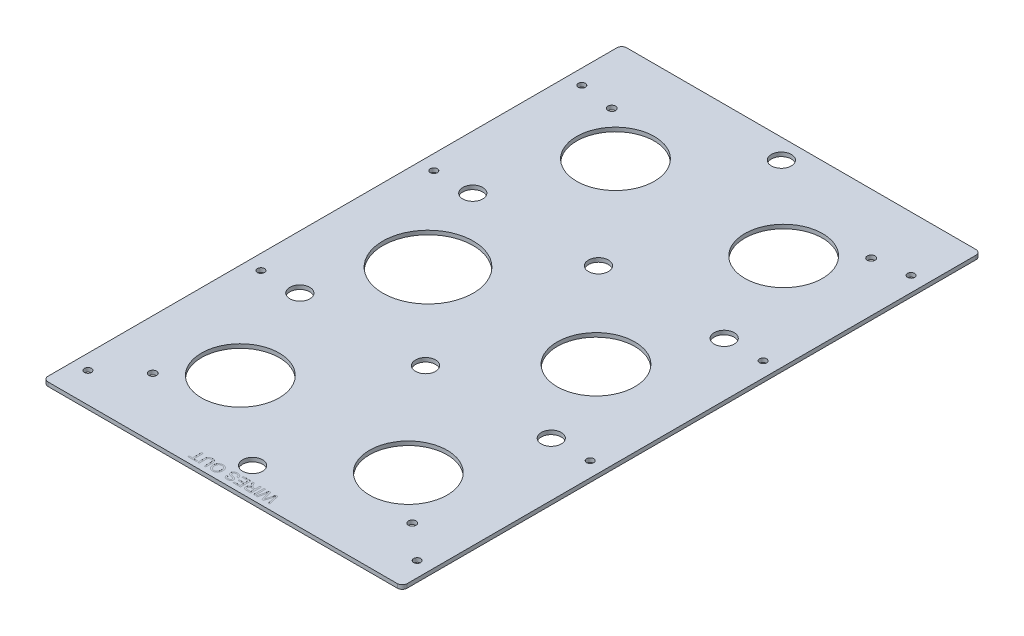
from build123d import *

# Parameters (mm, degrees)
SKETCH1_R           = 24.727
SKETCH1_R_2         = 28.76928198
SKETCH1_R_3         = 6.35
SKETCH1_R_4         = 2.45745
SKETCH1_R_5         = 2.2479
BOSS_EXTRUDE1_DEPTH = 2.54
SKETCH2_W           = 0.941716851
SKETCH2_H           = 6.677628581
CUT_EXTRUDE2_DEPTH  = 0.0254


with BuildPart() as part:
    # Sketch1 → Boss-Extrude1 (new body)
    with BuildSketch(Plane(origin=(0, 0, 0), x_dir=(1, 0, 0), z_dir=(0, 1, 0))):
        with BuildLine():
            Line((423.571752778, 200.667091319), (645.821752778, 200.667091319))
            ThreePointArc((645.821752778, 200.667091319), (648.066816808, 199.737155349), (648.996752778, 197.492091319))
            Line((648.996752778, 197.492091319), (648.996752778, -164.457908681))
            ThreePointArc((648.996752778, -164.457908681), (648.066816808, -166.702972712), (645.821752778, -167.632908681))
            Line((645.821752778, -167.632908681), (423.571752778, -167.632908681))
            ThreePointArc((423.571752778, -167.632908681), (421.326688747, -166.702972712), (420.396752778, -164.457908681))
            Line((420.396752778, -164.457908681), (420.396752778, 197.492091319))
            ThreePointArc((420.396752778, 197.492091319), (421.326688747, 199.737155349), (423.571752778, 200.667091319))
        make_face()
        with Locations((588.214552778, -102.991490365)):
            Circle(SKETCH1_R, mode=Mode.SUBTRACT)
        with Locations((588.214552778, 16.452800477)):
            Circle(SKETCH1_R, mode=Mode.SUBTRACT)
        with Locations((481.178952778, -102.862908681)):
            Circle(SKETCH1_R, mode=Mode.SUBTRACT)
        with Locations((481.178952778, 135.897091319)):
            Circle(SKETCH1_R, mode=Mode.SUBTRACT)
        with Locations((588.214552778, 135.897091319)):
            Circle(SKETCH1_R, mode=Mode.SUBTRACT)
        with Locations((481.178952778, 16.58138216)):
            Circle(SKETCH1_R_2, mode=Mode.SUBTRACT)
        with Locations((534.696752778, -148.582908681)):
            Circle(SKETCH1_R_3, mode=Mode.SUBTRACT)
        with Locations((614.706752778, -38.512008681)):
            Circle(SKETCH1_R_3, mode=Mode.SUBTRACT)
        with Locations((534.696752778, -38.516242015)):
            Circle(SKETCH1_R_3, mode=Mode.SUBTRACT)
        with Locations((454.686752778, -38.512008681)):
            Circle(SKETCH1_R_3, mode=Mode.SUBTRACT)
        with Locations((614.706752778, 71.546191319)):
            Circle(SKETCH1_R_3, mode=Mode.SUBTRACT)
        with Locations((534.696752778, 71.550424652)):
            Circle(SKETCH1_R_3, mode=Mode.SUBTRACT)
        with Locations((454.686752778, 71.546191319)):
            Circle(SKETCH1_R_3, mode=Mode.SUBTRACT)
        with Locations((534.696752778, 187.967091319)):
            Circle(SKETCH1_R_3, mode=Mode.SUBTRACT)
        with Locations((617.246752778, 162.567091319)):
            Circle(SKETCH1_R_4, mode=Mode.SUBTRACT)
        with Locations((452.146752778, 162.567091319)):
            Circle(SKETCH1_R_4, mode=Mode.SUBTRACT)
        with Locations((452.146752778, -129.532908681)):
            Circle(SKETCH1_R_4, mode=Mode.SUBTRACT)
        with Locations((617.246752778, -129.532908681)):
            Circle(SKETCH1_R_4, mode=Mode.SUBTRACT)
        with Locations((429.921752778, 165.742091319)):
            Circle(SKETCH1_R_5, mode=Mode.SUBTRACT)
        with Locations((429.921752778, 71.550424652)):
            Circle(SKETCH1_R_5, mode=Mode.SUBTRACT)
        with Locations((639.471752778, 165.742091319)):
            Circle(SKETCH1_R_5, mode=Mode.SUBTRACT)
        with Locations((639.471752778, 71.550424652)):
            Circle(SKETCH1_R_5, mode=Mode.SUBTRACT)
        with Locations((639.471752778, -38.516242015)):
            Circle(SKETCH1_R_5, mode=Mode.SUBTRACT)
        with Locations((429.921752778, -38.516242015)):
            Circle(SKETCH1_R_5, mode=Mode.SUBTRACT)
        with Locations((429.921752778, -148.582908681)):
            Circle(SKETCH1_R_5, mode=Mode.SUBTRACT)
        with Locations((639.471752778, -148.582908681)):
            Circle(SKETCH1_R_5, mode=Mode.SUBTRACT)
    extrude(amount=BOSS_EXTRUDE1_DEPTH)

    # Sketch2 → Cut-Extrude2 (cut)
    # profile 1 of 8: a face of its own
    with BuildSketch(Plane(origin=(0, 2.54, 0), x_dir=(1, 0, 0), z_dir=(0, 1, 0))):
        with BuildLine():
            Line((559.722342991, -157.632908681), (561.40378913, -164.310537262))
            Line((561.40378913, -164.310537262), (560.431305961, -164.310537262))
            Line((560.431305961, -164.310537262), (559.440095469, -159.918979844))
            add(Edge.make_bspline(
                [(559.440095469, -159.918979844), (559.388724776, -159.692489489), (559.286507843, -159.241821061), (559.185401446, -158.790902189), (559.135107625, -158.566599537)],
                knots=[0, 0, 0, 0, 1.00513078, 2, 2, 2, 2], degree=3))
            add(Edge.make_bspline(
                [(559.135107625, -158.566599537), (559.111295079, -158.647253219), (559.06634133, -158.799512675), (559.005572574, -159.015355126), (558.950378261, -159.203736415), (558.903355538, -159.365534749), (558.865281421, -159.500977443), (558.832408661, -159.608400186), (558.810002998, -159.689906664), (558.796725362, -159.734841456), (558.791327468, -159.753109262)],
                knots=[0, 0, 0, 0, 1.633809233, 3.084334118, 4.356383392, 5.447555203, 6.357852567, 7.089694452, 7.629924063, 8, 8, 8, 8], degree=3))
            Line((558.791327468, -159.753109262), (557.47238881, -164.310537262))
            Line((557.47238881, -164.310537262), (556.339385723, -164.310537262))
            Line((556.339385723, -164.310537262), (555.385629878, -160.965034642))
            add(Edge.make_bspline(
                [(555.385629878, -160.965034642), (555.332995836, -160.758362611), (555.229212897, -160.350850094), (555.091320512, -159.743845105), (554.964050247, -159.15156618), (554.890740185, -158.759838157), (554.854576483, -158.566599537)],
                knots=[0, 0, 0, 0, 1.04154457, 2.053700482, 3.039894486, 4, 4, 4, 4], degree=3))
            add(Edge.make_bspline(
                [(554.854576483, -158.566599537), (554.832195947, -158.665121557), (554.784917359, -158.873248025), (554.712211253, -159.201717256), (554.629692894, -159.562133235), (554.573549402, -159.813277801), (554.544237976, -159.944395498)],
                knots=[0, 0, 0, 0, 0.858436457, 1.813435672, 2.858437265, 4, 4, 4, 4], degree=3))
            Line((554.544237976, -159.944395498), (553.558378147, -164.310537262))
            Line((553.558378147, -164.310537262), (552.585894978, -164.310537262))
            Line((552.585894978, -164.310537262), (554.268678783, -157.632908681))
            Line((554.268678783, -157.632908681), (555.304032253, -157.632908681))
            Line((555.304032253, -157.632908681), (556.699217872, -162.736104402))
            add(Edge.make_bspline(
                [(556.699217872, -162.736104402), (556.713227546, -162.785992883), (556.739840708, -162.88076242), (556.774724331, -163.016001761), (556.809317368, -163.134939198), (556.836832717, -163.239111801), (556.860644948, -163.327469834), (556.881731697, -163.3997546), (556.895294127, -163.457380827), (556.905101846, -163.490133861), (556.909231431, -163.503924675)],
                knots=[0, 0, 0, 0, 1.562239628, 2.967673567, 4.210417925, 5.296319877, 6.215971374, 6.969386481, 7.566055473, 8, 8, 8, 8], degree=3))
            add(Edge.make_bspline(
                [(556.909231431, -163.503924675), (556.93405705, -163.416488876), (556.981082165, -163.250866474), (557.049566538, -163.0180006), (557.108445927, -162.81366071), (557.145087528, -162.687497031), (557.162050302, -162.629091123)],
                knots=[0, 0, 0, 0, 1.197732026, 2.268764715, 3.198546125, 4, 4, 4, 4], degree=3))
            Line((557.162050302, -162.629091123), (558.608067228, -157.632908681))
            Line((558.608067228, -157.632908681), (559.722342991, -157.632908681))
        make_face()
    # profile 2 of 8: a face of its own
    with BuildSketch(Plane(origin=(0, 2.54, 0), x_dir=(1, 0, 0), z_dir=(0, 1, 0))):
        with Locations((551.430151571, -160.971722972)):
            Rectangle(SKETCH2_W, SKETCH2_H)
    # profile 3 of 8: a face of its own
    with BuildSketch(Plane(origin=(0, 2.54, 0), x_dir=(1, 0, 0), z_dir=(0, 1, 0))):
        with BuildLine():
            Line((549.418301934, -157.632908681), (549.418301934, -164.310537262))
            Line((549.418301934, -164.310537262), (546.520917417, -164.310537262))
            add(Edge.make_bspline(
                [(546.520917417, -164.310537262), (546.452692559, -164.310005228), (546.32065133, -164.308975537), (546.129169583, -164.301617616), (545.95086287, -164.285985708), (545.784607427, -164.268526778), (545.630687741, -164.242748327), (545.489030458, -164.212505555), (545.360178866, -164.176762115), (545.243152545, -164.134511886), (545.134568815, -164.086727744), (545.033948542, -164.027737254), (544.936971287, -163.963207594), (544.84750278, -163.886763469), (544.761513388, -163.804632521), (544.682603234, -163.712705305), (544.608436978, -163.613282674), (544.518260608, -163.469308867), (544.423550867, -163.276322235), (544.341975762, -163.031134683), (544.290104766, -162.774393872), (544.284505479, -162.599018952), (544.281664564, -162.510038851)],
                knots=[0, 0, 0, 0, 1.242075696, 2.40389213, 3.487198984, 4.500157661, 5.446319301, 6.326791195, 7.136300648, 7.878370406, 8.590488565, 9.292260633, 9.999224673, 10.708050372, 11.431369221, 12.162165018, 12.910600795, 13.687589445, 15.252257874, 16.810406251, 18.381693487, 20, 20, 20, 20], degree=3))
            add(Edge.make_bspline(
                [(544.281664564, -162.510038851), (544.28297127, -162.452917353), (544.285552103, -162.340098479), (544.305321257, -162.174224351), (544.341092711, -162.015738993), (544.386960042, -161.863251141), (544.449747785, -161.718933253), (544.522451415, -161.579793134), (544.612647929, -161.449818753), (544.713357171, -161.324666237), (544.830463791, -161.209983484), (544.960726064, -161.103989028), (545.1080602, -161.013027964), (545.267633909, -160.928495648), (545.443559659, -160.859072611), (545.633184323, -160.797943376), (545.83797549, -160.750811011), (545.979919299, -160.727069922), (546.052734324, -160.714891103)],
                knots=[0, 0, 0, 0, 0.982645791, 1.940792824, 2.867691729, 3.775150443, 4.675643875, 5.571354211, 6.471357401, 7.392684514, 8.331098131, 9.285922955, 10.275520706, 11.304845665, 12.388884831, 13.524255008, 14.729980297, 16, 16, 16, 16], degree=3))
            add(Edge.make_bspline(
                [(546.052734324, -160.714891103), (545.998803964, -160.688009316), (545.896529863, -160.63703041), (545.757356704, -160.552682069), (545.635434829, -160.473275324), (545.56617817, -160.413731461), (545.533719923, -160.385825272)],
                knots=[0, 0, 0, 0, 1.172551213, 2.223638478, 3.167479604, 4, 4, 4, 4], degree=3))
            add(Edge.make_bspline(
                [(545.533719923, -160.385825272), (545.470531772, -160.324072838), (545.34094328, -160.197428765), (545.164102858, -159.979716317), (544.989121368, -159.740294935), (544.884066136, -159.565824165), (544.830107616, -159.476212404)],
                knots=[0, 0, 0, 0, 0.918170575, 1.883016652, 2.912673989, 4, 4, 4, 4], degree=3))
            Line((544.830107616, -159.476212404), (543.734559177, -157.632908681))
            Line((543.734559177, -157.632908681), (544.814055625, -157.632908681))
            Line((544.814055625, -157.632908681), (545.646083865, -159.042808626))
            add(Edge.make_bspline(
                [(545.646083865, -159.042808626), (545.676001254, -159.092275432), (545.73397624, -159.18813398), (545.81768902, -159.328150929), (545.899877098, -159.456985803), (545.975734741, -159.578649241), (546.050072727, -159.689932731), (546.116711758, -159.795047844), (546.183634726, -159.888039759), (546.260477146, -159.999758964), (546.354320897, -160.12054763), (546.46382992, -160.244632721), (546.56451618, -160.347419301), (546.691748968, -160.445491362), (546.849956269, -160.53528591), (546.983347585, -160.577882041), (547.047957814, -160.598514163)],
                knots=[0, 0, 0, 0, 1.130591283, 2.190900266, 3.190104209, 4.119071823, 4.994606968, 5.807262858, 6.55236009, 7.234593472, 8.459046683, 9.540234366, 10.471327768, 11.266723835, 12.676093724, 14, 14, 14, 14], degree=3))
            add(Edge.make_bspline(
                [(547.047957814, -160.598514163), (547.075100451, -160.603408903), (547.137067905, -160.614583741), (547.242288488, -160.621882045), (547.369776133, -160.629628219), (547.462168601, -160.629402522), (547.51212791, -160.62928048)],
                knots=[0, 0, 0, 0, 0.709978628, 1.620902492, 2.713552433, 4, 4, 4, 4], degree=3))
            Line((547.51212791, -160.62928048), (548.476585083, -160.62928048))
            Line((548.476585083, -160.62928048), (548.476585083, -157.632908681))
            Line((548.476585083, -157.632908681), (549.418301934, -157.632908681))
        make_face()
        with BuildLine():
            Line((548.476585083, -161.399776086), (546.688125665, -161.399776086))
            add(Edge.make_bspline(
                [(546.688125665, -161.399776086), (546.598441482, -161.401167081), (546.430785313, -161.403767415), (546.196404283, -161.426311968), (545.995914421, -161.461552337), (545.826754763, -161.515076519), (545.684592564, -161.586755961), (545.561380252, -161.674412982), (545.457780216, -161.783162134), (545.372578132, -161.907859175), (545.305973355, -162.043753081), (545.259433313, -162.187580097), (545.22818796, -162.336582269), (545.224993173, -162.438537714), (545.223381415, -162.489973861)],
                knots=[0, 0, 0, 0, 1.546056516, 2.890207646, 4.055830773, 5.050253158, 5.937355789, 6.790906573, 7.644595853, 8.512568064, 9.38593768, 10.244184789, 11.114197691, 12, 12, 12, 12], degree=3))
            add(Edge.make_bspline(
                [(545.223381415, -162.489973861), (545.224618751, -162.527458437), (545.227042329, -162.600879709), (545.239882746, -162.708606586), (545.264312756, -162.810695223), (545.298047274, -162.907881527), (545.340760095, -163.000376502), (545.393247395, -163.08781636), (545.455238343, -163.169754494), (545.526349228, -163.246594289), (545.60796875, -163.316521605), (545.701205409, -163.376850866), (545.805314667, -163.428118515), (545.920420133, -163.468807733), (546.046158457, -163.501352546), (546.183245656, -163.523003545), (546.331054739, -163.538670141), (546.433477865, -163.539575943), (546.486138102, -163.540041657)],
                knots=[0, 0, 0, 0, 0.965235723, 1.89061323, 2.787065514, 3.661873922, 4.534873316, 5.404925039, 6.281839248, 7.175200054, 8.095223355, 9.040740021, 10.02630299, 11.075573487, 12.177989335, 13.364883635, 14.645170704, 16, 16, 16, 16], degree=3))
            Line((546.486138102, -163.540041657), (548.476585083, -163.540041657))
            Line((548.476585083, -163.540041657), (548.476585083, -161.399776086))
        make_face(mode=Mode.SUBTRACT)
    # profile 4 of 8: a face of its own
    with BuildSketch(Plane(origin=(0, 2.54, 0), x_dir=(1, 0, 0), z_dir=(0, 1, 0))):
        Polygon((542.740673353, -157.632908681), (542.740673353, -164.310537262), (538.032089097, -164.310537262), (538.032089097, -163.540041657), (541.798956502, -163.540041657), (541.798956502, -161.485386709), (538.288920966, -161.485386709), (538.288920966, -160.714891103), (541.798956502, -160.714891103), (541.798956502, -158.403404287), (537.860867852, -158.403404287), (537.860867852, -157.632908681), align=None)
    # profile 5 of 8: a face of its own
    with BuildSketch(Plane(origin=(0, 2.54, 0), x_dir=(1, 0, 0), z_dir=(0, 1, 0))):
        with BuildLine():
            Line((536.919151001, -159.944395498), (535.977434149, -159.944395498))
            add(Edge.make_bspline(
                [(535.977434149, -159.944395498), (535.967099447, -159.859829448), (535.947245927, -159.697373513), (535.891294024, -159.467321186), (535.820807728, -159.25994257), (535.728061286, -159.075450502), (535.61414462, -158.90945451), (535.471617002, -158.762452209), (535.300465931, -158.633409818), (535.104726492, -158.523070597), (534.890547961, -158.430125565), (534.659820918, -158.364923014), (534.415960386, -158.325384135), (534.2488754, -158.320359384), (534.163559078, -158.317793664)],
                knots=[0, 0, 0, 0, 1.125761249, 2.162647979, 3.12492346, 4.01623828, 4.884793378, 5.777219259, 6.711258599, 7.709587174, 8.742442187, 9.791331093, 10.872217593, 12, 12, 12, 12], degree=3))
            add(Edge.make_bspline(
                [(534.163559078, -158.317793664), (534.088075472, -158.319197344), (533.941338698, -158.321926035), (533.728224529, -158.354491854), (533.528255497, -158.402670123), (533.343591959, -158.471961543), (533.177945071, -158.559061508), (533.030912287, -158.658515842), (532.90896415, -158.777039758), (532.810320251, -158.908038635), (532.733767063, -159.0471478), (532.68039687, -159.190660225), (532.64446456, -159.335781279), (532.640558852, -159.434093517), (532.638619859, -159.482900734)],
                knots=[0, 0, 0, 0, 1.267544124, 2.464049433, 3.614542348, 4.719673496, 5.768837234, 6.754183997, 7.692231426, 8.612479311, 9.501217876, 10.350240008, 11.180974857, 12, 12, 12, 12], degree=3))
            add(Edge.make_bspline(
                [(532.638619859, -159.482900734), (532.640665535, -159.531229084), (532.644667914, -159.625783812), (532.676417933, -159.762658445), (532.727722813, -159.890016468), (532.799690966, -160.00894435), (532.897502083, -160.118722921), (533.023983613, -160.216173588), (533.175612186, -160.308864856), (533.289773133, -160.358297227), (533.350258161, -160.384487606)],
                knots=[0, 0, 0, 0, 0.942081658, 1.843188798, 2.725198023, 3.611401405, 4.541884661, 5.575766242, 6.715586633, 8, 8, 8, 8], degree=3))
            add(Edge.make_bspline(
                [(533.350258161, -160.384487606), (533.373783734, -160.394141859), (533.426932275, -160.415952572), (533.518027268, -160.444823213), (533.626118392, -160.482172301), (533.753417286, -160.520437731), (533.900055849, -160.561437411), (534.064688983, -160.608621488), (534.248622783, -160.657756276), (534.445415748, -160.709772669), (534.644614114, -160.762532304), (534.834897576, -160.816478017), (535.011047166, -160.86764307), (535.172392375, -160.920229175), (535.319087714, -160.972129915), (535.451533958, -161.023009908), (535.569966713, -161.071603021), (535.642299162, -161.107339688), (535.676459303, -161.124216894)],
                knots=[0, 0, 0, 0, 0.499208779, 1.12780332, 1.87546358, 2.745246929, 3.737578632, 4.865834649, 6.108484299, 7.476352792, 8.863398792, 10.155242256, 11.360521946, 12.465428895, 13.487415091, 14.415997097, 15.251929613, 16, 16, 16, 16], degree=3))
            add(Edge.make_bspline(
                [(535.676459303, -161.124216894), (535.755002663, -161.166726358), (535.906611787, -161.248780688), (536.111451179, -161.394622954), (536.281150592, -161.559612867), (536.42109584, -161.737381778), (536.529142747, -161.928850953), (536.605479995, -162.131923291), (536.65505586, -162.345806507), (536.65987107, -162.492817705), (536.662319132, -162.567558488)],
                knots=[0, 0, 0, 0, 1.158956011, 2.237086722, 3.252429106, 4.221720014, 5.165272549, 6.094237939, 7.031106807, 8, 8, 8, 8], degree=3))
            add(Edge.make_bspline(
                [(536.662319132, -162.567558488), (536.659145253, -162.650346649), (536.652832429, -162.815011702), (536.59669433, -163.056600056), (536.507282806, -163.289830041), (536.404288244, -163.474420688), (536.305316187, -163.614577488), (536.222135201, -163.713957894), (536.130348142, -163.806380687), (536.03196227, -163.89376346), (535.923425255, -163.972838858), (535.807988168, -164.046251884), (535.68328631, -164.112037731), (535.50673448, -164.192242907), (535.271906117, -164.274474337), (534.976237199, -164.345718883), (534.665033701, -164.387424656), (534.452620181, -164.393199013), (534.344143986, -164.396147885)],
                knots=[0, 0, 0, 0, 1.200056028, 2.386902731, 3.579012093, 4.815906327, 5.442508847, 6.067203999, 6.694073756, 7.331409728, 7.974631341, 8.640655778, 9.315145047, 10.018831381, 11.453504181, 12.917815188, 14.425977399, 16, 16, 16, 16], degree=3))
            add(Edge.make_bspline(
                [(534.344143986, -164.396147885), (534.225391409, -164.393512718), (533.994599467, -164.388391352), (533.659011915, -164.343225433), (533.345074452, -164.270447043), (533.099322959, -164.184703485), (532.91716066, -164.099475426), (532.78875982, -164.030796118), (532.669168796, -163.953393884), (532.556105476, -163.871439291), (532.453610512, -163.77959394), (532.357450754, -163.682688125), (532.269243926, -163.578853804), (532.164495795, -163.430552422), (532.053850912, -163.232219998), (531.953928801, -162.977837198), (531.889942405, -162.707360999), (531.875474296, -162.521515965), (531.868124254, -162.42710356)],
                knots=[0, 0, 0, 0, 1.607451709, 3.124032445, 4.575401297, 5.965664223, 6.638286369, 7.297495781, 7.935629741, 8.566004073, 9.186263309, 9.796807256, 10.413736732, 11.028594479, 12.253110936, 13.478624344, 14.719098735, 16, 16, 16, 16], degree=3))
            Line((531.868124254, -162.42710356), (532.809841105, -162.42710356))
            add(Edge.make_bspline(
                [(532.809841105, -162.42710356), (532.81562815, -162.4749674), (532.82696333, -162.568719073), (532.858762759, -162.70345659), (532.896799486, -162.830012271), (532.945167565, -162.946963749), (533.002893506, -163.055345187), (533.07136604, -163.153920439), (533.147875112, -163.244555146), (533.234266603, -163.325658718), (533.331357869, -163.396884385), (533.439169244, -163.458441163), (533.557300996, -163.511053804), (533.686899001, -163.551613997), (533.826230383, -163.585296013), (533.976898124, -163.609473802), (534.138375502, -163.621998491), (534.249596497, -163.624412897), (534.306689338, -163.625652279)],
                knots=[0, 0, 0, 0, 1.074256797, 2.104164074, 3.082231143, 4.018364317, 4.921387537, 5.814946689, 6.689553043, 7.561782592, 8.450683137, 9.368204304, 10.325224224, 11.328240899, 12.391723181, 13.519579538, 14.726730929, 16, 16, 16, 16], degree=3))
            add(Edge.make_bspline(
                [(534.306689338, -163.625652279), (534.366035525, -163.625210853), (534.480915147, -163.624356359), (534.64695209, -163.608493069), (534.800971481, -163.587108964), (534.942023864, -163.554283581), (535.071425464, -163.515663761), (535.186906528, -163.46380454), (535.291219455, -163.40534535), (535.382461854, -163.336821312), (535.461105742, -163.260852496), (535.531689661, -163.182815544), (535.588602258, -163.098627915), (535.63871673, -163.012951296), (535.673634386, -162.921228935), (535.701043956, -162.827451385), (535.717710478, -162.729557833), (535.719625026, -162.663042802), (535.720602281, -162.629091123)],
                knots=[0, 0, 0, 0, 1.464224776, 2.834379057, 4.11387117, 5.299348816, 6.406355048, 7.441191667, 8.417293255, 9.352838038, 10.248153785, 11.113750317, 11.944205591, 12.75240885, 13.557683963, 14.358962649, 15.162355132, 16, 16, 16, 16], degree=3))
            add(Edge.make_bspline(
                [(535.720602281, -162.629091123), (535.718168663, -162.571639742), (535.713445235, -162.460131908), (535.665212127, -162.30171289), (535.59102927, -162.15730369), (535.517947336, -162.078731382), (535.48116007, -162.039180425)],
                knots=[0, 0, 0, 0, 1.050964922, 2.039826012, 3.013306874, 4, 4, 4, 4], degree=3))
            add(Edge.make_bspline(
                [(535.48116007, -162.039180425), (535.457969771, -162.019414746), (535.406685856, -161.975704166), (535.311264203, -161.917858418), (535.192955623, -161.859412216), (535.050968951, -161.801314272), (534.885551449, -161.742847517), (534.696956535, -161.682692414), (534.484109364, -161.622638631), (534.25405831, -161.56570571), (534.021978303, -161.507248785), (533.801731722, -161.449648546), (533.598727955, -161.395820096), (533.415304405, -161.339779945), (533.24844288, -161.290624887), (533.101451026, -161.238724735), (532.971688042, -161.191625956), (532.892222033, -161.15838142), (532.855321748, -161.142944217)],
                knots=[0, 0, 0, 0, 0.523895407, 1.158562347, 1.913798076, 2.79478753, 3.797549825, 4.933675542, 6.202127117, 7.604032848, 9.013379355, 10.32225155, 11.523321485, 12.628397413, 13.623935419, 14.51727859, 15.311493772, 16, 16, 16, 16], degree=3))
            add(Edge.make_bspline(
                [(532.855321748, -161.142944217), (532.807300629, -161.120819928), (532.713043221, -161.077393655), (532.579670537, -161.003035247), (532.454410737, -160.926481026), (532.341164328, -160.842122338), (532.234366601, -160.757650818), (532.139464727, -160.666329918), (532.054417312, -160.570308455), (531.953674878, -160.438378462), (531.850336256, -160.260306632), (531.761549753, -160.030161174), (531.7060115, -159.784270007), (531.699976744, -159.614733125), (531.696903008, -159.528381377)],
                knots=[0, 0, 0, 0, 0.899363591, 1.76530001, 2.59691609, 3.395188894, 4.166615117, 4.912545108, 5.632755751, 6.347510175, 7.734752518, 9.118421309, 10.532299558, 12, 12, 12, 12], degree=3))
            add(Edge.make_bspline(
                [(531.696903008, -159.528381377), (531.700443023, -159.441124746), (531.707488803, -159.267455692), (531.766370035, -159.011848), (531.860846991, -158.764675669), (531.970194907, -158.568583503), (532.073971507, -158.418582646), (532.161120281, -158.310759961), (532.257770914, -158.211063889), (532.361534971, -158.116367519), (532.473220907, -158.028605511), (532.59376808, -157.947741253), (532.721910394, -157.872958183), (532.904868974, -157.781728519), (533.148158262, -157.686990369), (533.457107708, -157.604818345), (533.783892935, -157.556127476), (534.007778273, -157.550282456), (534.122091433, -157.547298058)],
                knots=[0, 0, 0, 0, 1.196987384, 2.382393894, 3.582009067, 4.820735309, 5.454243406, 6.085350439, 6.72189866, 7.359035515, 8.013098289, 8.67027723, 9.350744424, 10.048966745, 11.475869723, 12.9268444, 14.430883741, 16, 16, 16, 16], degree=3))
            add(Edge.make_bspline(
                [(534.122091433, -157.547298058), (534.194787777, -157.547975042), (534.337634537, -157.549305301), (534.547073108, -157.562493925), (534.747206944, -157.586322036), (534.938836729, -157.613902371), (535.121058459, -157.655354933), (535.294917718, -157.702126873), (535.458828623, -157.760803852), (535.614596134, -157.825361377), (535.760794209, -157.901642644), (535.900492499, -157.983398277), (536.030310426, -158.077181973), (536.154094296, -158.176638928), (536.268109269, -158.287282967), (536.373674536, -158.406532114), (536.47193749, -158.534115384), (536.561156051, -158.670170701), (536.640803351, -158.81313801), (536.712505816, -158.960532385), (536.77251151, -159.113140053), (536.821961187, -159.270602244), (536.862439284, -159.432204152), (536.8913014, -159.599022237), (536.912253487, -159.770009971), (536.916838249, -159.885923643), (536.919151001, -159.944395498)],
                knots=[0, 0, 0, 0, 1.259929758, 2.475735005, 3.634725603, 4.752877801, 5.82919746, 6.871690464, 7.871395985, 8.84458164, 9.791640072, 10.727373556, 11.647336026, 12.564665335, 13.477425593, 14.397128332, 15.323044476, 16.266184727, 17.214251675, 18.157898412, 19.105082968, 20.053433368, 21.01687335, 21.990151059, 22.98614553, 24, 24, 24, 24], degree=3))
        make_face()
    # profile 6 of 8: a face of its own
    with BuildSketch(Plane(origin=(0, 2.54, 0), x_dir=(1, 0, 0), z_dir=(0, 1, 0))):
        with BuildLine():
            add(Edge.make_bspline(
                [(528.186867472, -160.883437017), (528.18453093, -161.017312794), (528.179978296, -161.278162957), (528.137941893, -161.658076342), (528.068593879, -162.015098517), (527.973198508, -162.350880998), (527.846319517, -162.66289135), (527.695771151, -162.954966283), (527.513106957, -163.222022193), (527.306708274, -163.467146872), (527.076107188, -163.683835182), (526.830598567, -163.876290687), (526.567097553, -164.036820026), (526.28804371, -164.169364681), (525.992250127, -164.271128541), (525.680547659, -164.342372526), (525.353269573, -164.388331813), (525.129567345, -164.393504685), (525.015261429, -164.396147885)],
                knots=[0, 0, 0, 0, 1.203593535, 2.345140965, 3.431924157, 4.471254512, 5.478692091, 6.45615896, 7.42038538, 8.382007041, 9.33218277, 10.260966195, 11.182476517, 12.100814648, 13.034113903, 13.98924309, 14.972556454, 16, 16, 16, 16], degree=3))
            add(Edge.make_bspline(
                [(525.015261429, -164.396147885), (524.939866448, -164.394843312), (524.790145653, -164.392252667), (524.568399649, -164.3721473), (524.352618273, -164.337238773), (524.142675062, -164.288675423), (523.938260336, -164.227577692), (523.73950904, -164.152118347), (523.546103587, -164.063842538), (523.359775663, -163.961244553), (523.181848561, -163.8457953), (523.013048497, -163.720694705), (522.855997914, -163.583433614), (522.709938897, -163.435833724), (522.573742411, -163.277970932), (522.451761008, -163.106896927), (522.336774764, -162.928014603), (522.235961336, -162.737217508), (522.144571604, -162.538889961), (522.067967494, -162.33217238), (522.000128037, -162.120027321), (521.945351476, -161.901137147), (521.904520595, -161.674877343), (521.873123308, -161.44287377), (521.856169491, -161.203837004), (521.853190039, -161.042642875), (521.851681382, -160.961021644)],
                knots=[0, 0, 0, 0, 1.034176269, 2.053687022, 3.051235935, 4.030520976, 5.007759882, 5.975670013, 6.944584641, 7.921900115, 8.890679583, 9.85222947, 10.801660264, 11.7488817, 12.698942795, 13.658174729, 14.62880618, 15.613957309, 16.61577279, 17.622338666, 18.636016077, 19.670029534, 20.714984856, 21.788550191, 22.880224384, 24, 24, 24, 24], degree=3))
            add(Edge.make_bspline(
                [(521.851681382, -160.961021644), (521.853072713, -160.87805609), (521.855821525, -160.714143333), (521.874421114, -160.47199404), (521.907125658, -160.236796351), (521.950502666, -160.007848949), (522.008626533, -159.785628455), (522.077697817, -159.569497748), (522.161243435, -159.36074415), (522.255598947, -159.158864507), (522.362362122, -158.966635418), (522.480129319, -158.785400846), (522.608983195, -158.6168568), (522.746969289, -158.458933097), (522.896846371, -158.314898626), (523.05745678, -158.182609526), (523.228472072, -158.062634985), (523.409221897, -157.954267331), (523.596818494, -157.858979835), (523.788984061, -157.774772138), (523.98594523, -157.706640897), (524.18482042, -157.646211439), (524.388571028, -157.602759574), (524.595275781, -157.57038093), (524.806233365, -157.551447507), (524.947895826, -157.548688315), (525.019274427, -157.547298058)],
                knots=[0, 0, 0, 0, 1.141458971, 2.255149016, 3.338763392, 4.407145747, 5.45911027, 6.497028761, 7.526847988, 8.550472592, 9.561035647, 10.549629976, 11.521388012, 12.477647518, 13.432134385, 14.377847498, 15.337760086, 16.303574593, 17.274809663, 18.230970776, 19.187525402, 20.140611526, 21.088808525, 22.051011914, 23.017975238, 24, 24, 24, 24], degree=3))
            add(Edge.make_bspline(
                [(525.019274427, -157.547298058), (525.096012226, -157.548486946), (525.248010587, -157.550841835), (525.472905681, -157.572522757), (525.691462139, -157.609637941), (525.904930207, -157.656227701), (526.110934371, -157.721638318), (526.311198264, -157.798708143), (526.504237219, -157.891974124), (526.691042947, -157.997332028), (526.869942046, -158.114136731), (527.037141566, -158.243512661), (527.195108541, -158.380916881), (527.339031948, -158.53167661), (527.473222178, -158.691075567), (527.59722857, -158.86049706), (527.709298938, -159.040789768), (527.808812233, -159.230989268), (527.89854682, -159.426268703), (527.974191087, -159.626526161), (528.040656527, -159.828854312), (528.093592291, -160.034488525), (528.135774912, -160.24295756), (528.164139843, -160.453913699), (528.184625162, -160.66767135), (528.186116274, -160.811153192), (528.186867472, -160.883437017)],
                knots=[0, 0, 0, 0, 1.072846099, 2.125039441, 3.155166917, 4.171599398, 5.177324298, 6.174217088, 7.169783185, 8.172042761, 9.17156421, 10.154239632, 11.126115549, 12.096189878, 13.065322046, 14.038037562, 15.029377678, 16.03062832, 17.03785952, 18.032507603, 19.022297599, 20.014323703, 20.999862951, 21.994471951, 22.989647507, 24, 24, 24, 24], degree=3))
        make_face()
        with BuildLine():
            add(Edge.make_bspline(
                [(527.245150621, -160.872735689), (527.243708302, -160.776329083), (527.240895881, -160.588343004), (527.208690701, -160.314276393), (527.159881949, -160.055654115), (527.092407359, -159.811871377), (527.002320553, -159.584720283), (526.892178815, -159.373764636), (526.762979833, -159.178007343), (526.614791589, -158.999666854), (526.451965372, -158.839404017), (526.277966179, -158.699361725), (526.09295566, -158.582585312), (525.899383325, -158.485046703), (525.694682655, -158.409893563), (525.479834363, -158.356767024), (525.254842663, -158.323605931), (525.101434122, -158.319755224), (525.023287425, -158.317793664)],
                knots=[0, 0, 0, 0, 1.215616022, 2.370365452, 3.475740397, 4.533490648, 5.5560781, 6.552384115, 7.530550651, 8.509299237, 9.471863928, 10.40830403, 11.321168121, 12.226759389, 13.137923578, 14.065605683, 15.014614662, 16, 16, 16, 16], degree=3))
            add(Edge.make_bspline(
                [(525.023287425, -158.317793664), (524.943815434, -158.319782821), (524.788209501, -158.323677584), (524.559835716, -158.356279258), (524.342855037, -158.41178221), (524.135116888, -158.48566924), (523.940376641, -158.585551808), (523.754081126, -158.70251411), (523.581304071, -158.845437297), (523.417822665, -159.005988288), (523.271136039, -159.188463496), (523.141191885, -159.388463733), (523.034906145, -159.608474381), (522.946244788, -159.845331361), (522.876697283, -160.100521086), (522.828077065, -160.374041317), (522.798093374, -160.665171053), (522.794990953, -160.865080504), (522.793398234, -160.967709974)],
                knots=[0, 0, 0, 0, 0.976909331, 1.912785716, 2.828990727, 3.727421029, 4.617481149, 5.514840137, 6.426786422, 7.368873452, 8.327895072, 9.299698503, 10.295216142, 11.325792517, 12.405818789, 13.542541501, 14.738390493, 16, 16, 16, 16], degree=3))
            add(Edge.make_bspline(
                [(522.793398234, -160.967709974), (522.793966817, -161.033732037), (522.795082171, -161.163243432), (522.809853214, -161.354144706), (522.828905939, -161.539107878), (522.857914108, -161.717894183), (522.897890696, -161.889763569), (522.942179158, -162.056023251), (522.997555895, -162.215244923), (523.060404202, -162.368036925), (523.130673783, -162.513672955), (523.210133001, -162.650715697), (523.297093882, -162.779619866), (523.392457283, -162.899810031), (523.493812389, -163.012983378), (523.604385712, -163.116197704), (523.722355729, -163.211506416), (523.847737201, -163.297934487), (523.978517976, -163.375626724), (524.114034326, -163.442630081), (524.253854585, -163.499436079), (524.397834997, -163.543948273), (524.545109246, -163.580697562), (524.696032489, -163.607919019), (524.851787309, -163.622190414), (524.956824445, -163.624490038), (525.009910765, -163.625652279)],
                knots=[0, 0, 0, 0, 1.220320263, 2.393826742, 3.538159925, 4.657606474, 5.739544833, 6.799495376, 7.837090465, 8.853610905, 9.852768056, 10.824163015, 11.779900663, 12.724912201, 13.658747054, 14.586045767, 15.518168864, 16.460299482, 17.399069918, 18.328125852, 19.252745725, 20.186143833, 21.111865538, 22.057883325, 23.018444021, 24, 24, 24, 24], degree=3))
            add(Edge.make_bspline(
                [(525.009910765, -163.625652279), (525.084938405, -163.62413704), (525.2334181, -163.621138382), (525.451376593, -163.58873435), (525.661743896, -163.539950676), (525.863052399, -163.469485129), (526.057596501, -163.381020679), (526.243137396, -163.270879074), (526.420855875, -163.141370475), (526.589996678, -162.993045954), (526.747641543, -162.821928541), (526.88098862, -162.620316572), (526.99335615, -162.392876807), (527.087187004, -162.140227578), (527.158728602, -161.860400125), (527.208173256, -161.554602259), (527.239391474, -161.22251068), (527.243181828, -160.992308022), (527.245150621, -160.872735689)],
                knots=[0, 0, 0, 0, 0.895098135, 1.771399171, 2.624879489, 3.470001555, 4.31324378, 5.172350046, 6.041214072, 6.935108351, 7.854676913, 8.809932058, 9.809814619, 10.877726151, 12.02168834, 13.252153056, 14.572707754, 16, 16, 16, 16], degree=3))
        make_face(mode=Mode.SUBTRACT)
    # profile 7 of 8: a face of its own
    with BuildSketch(Plane(origin=(0, 2.54, 0), x_dir=(1, 0, 0), z_dir=(0, 1, 0))):
        with BuildLine():
            Line((516.458212144, -164.310537262), (515.516495293, -164.310537262))
            Line((515.516495293, -164.310537262), (515.516495293, -160.468760563))
            add(Edge.make_bspline(
                [(515.516495293, -160.468760563), (515.517474742, -160.387156485), (515.519380752, -160.228354816), (515.528099819, -159.996753507), (515.545247733, -159.778047234), (515.570926405, -159.572909076), (515.601614931, -159.380068868), (515.637870071, -159.200177898), (515.684070646, -159.033396571), (515.73592839, -158.877894118), (515.797680497, -158.732300388), (515.870703208, -158.594527028), (515.954628254, -158.463708864), (516.050401785, -158.340133824), (516.15650166, -158.223051385), (516.274176481, -158.113387654), (516.403954343, -158.011901358), (516.542544728, -157.914755937), (516.693597314, -157.82787793), (516.85677961, -157.752940569), (517.031044574, -157.688483224), (517.217240731, -157.636663499), (517.414513571, -157.597061551), (517.622577363, -157.567449326), (517.841946627, -157.549945429), (517.992037215, -157.548193584), (518.068761986, -157.547298058)],
                knots=[0, 0, 0, 0, 1.311377147, 2.551942077, 3.723550895, 4.835332178, 5.873100029, 6.860965504, 7.782222652, 8.65229484, 9.493385443, 10.320318369, 11.155067733, 11.987723446, 12.829729107, 13.691560723, 14.568860379, 15.475173283, 16.409214366, 17.364531151, 18.357450607, 19.391849073, 20.466818896, 21.588529868, 22.767281177, 24, 24, 24, 24], degree=3))
            add(Edge.make_bspline(
                [(518.068761986, -157.547298058), (518.143692569, -157.548400696), (518.289688964, -157.5505491), (518.503632052, -157.565085675), (518.707145674, -157.590821222), (518.900813195, -157.624675537), (519.083680787, -157.670171778), (519.255529949, -157.726777189), (519.417480536, -157.792065904), (519.56972932, -157.866608761), (519.710003689, -157.953336504), (519.841917812, -158.045959962), (519.961569414, -158.150332967), (520.071262217, -158.262523444), (520.171160029, -158.383453497), (520.259305482, -158.514276412), (520.339114444, -158.653115978), (520.405354703, -158.803560298), (520.465158932, -158.964133111), (520.515280255, -159.138210826), (520.558077542, -159.325793639), (520.592119331, -159.527314667), (520.621007779, -159.742695434), (520.638209453, -159.972720901), (520.651135927, -160.216240933), (520.652455564, -160.383130474), (520.653132663, -160.468760563)],
                knots=[0, 0, 0, 0, 1.193078897, 2.324621146, 3.412165798, 4.458033356, 5.453301711, 6.409727336, 7.336550967, 8.231923267, 9.10494906, 9.959977801, 10.795507141, 11.62892236, 12.456145611, 13.289107106, 14.138012467, 15.002334476, 15.903094886, 16.864671381, 17.884255983, 18.965082669, 20.117808422, 21.342986352, 22.636701193, 24, 24, 24, 24], degree=3))
            Line((520.653132663, -160.468760563), (520.653132663, -164.310537262))
            Line((520.653132663, -164.310537262), (519.711415812, -164.310537262))
            Line((519.711415812, -164.310537262), (519.711415812, -160.51290354))
            add(Edge.make_bspline(
                [(519.711415812, -160.51290354), (519.710799764, -160.443787538), (519.709611091, -160.310427194), (519.703426209, -160.117238064), (519.691005445, -159.937965789), (519.675840475, -159.772749518), (519.654519328, -159.621830699), (519.627717537, -159.485299875), (519.597429094, -159.362366447), (519.552266839, -159.218480939), (519.476199798, -159.058491588), (519.360985792, -158.885777771), (519.213285858, -158.740744756), (519.042154724, -158.61773199), (518.846596251, -158.521791039), (518.630053412, -158.451953789), (518.392748243, -158.410132867), (518.227672055, -158.40569731), (518.142333615, -158.403404287)],
                knots=[0, 0, 0, 0, 1.090438201, 2.104016592, 3.048763244, 3.925116223, 4.720979001, 5.45216101, 6.119252661, 6.717681473, 7.82855347, 8.901677854, 9.976092604, 11.075141713, 12.213970494, 13.397440122, 14.654570346, 16, 16, 16, 16], degree=3))
            add(Edge.make_bspline(
                [(518.142333615, -158.403404287), (518.069169328, -158.40464865), (517.927896494, -158.407051389), (517.724189867, -158.426462835), (517.53742253, -158.461767808), (517.365719832, -158.507621427), (517.210466833, -158.569105909), (517.070548494, -158.643564342), (516.949665317, -158.735061795), (516.840288012, -158.837770943), (516.74792355, -158.962803982), (516.670739978, -159.11139225), (516.60417573, -159.283658397), (516.549665322, -159.481239811), (516.50985742, -159.704375213), (516.478758604, -159.95166976), (516.462447162, -160.224197505), (516.459664455, -160.413897858), (516.458212144, -160.51290354)],
                knots=[0, 0, 0, 0, 1.111591514, 2.146370713, 3.104407205, 3.996889121, 4.842307775, 5.6365848, 6.396727704, 7.139400744, 7.909024799, 8.745519786, 9.676513234, 10.710427131, 11.854494362, 13.117490512, 14.495602074, 16, 16, 16, 16], degree=3))
            Line((516.458212144, -160.51290354), (516.458212144, -164.310537262))
        make_face()
    # profile 8 of 8: a face of its own
    with BuildSketch(Plane(origin=(0, 2.54, 0), x_dir=(1, 0, 0), z_dir=(0, 1, 0))):
        Polygon((512.348902248, -157.632908681), (512.348902248, -163.540041657), (514.489167819, -163.540041657), (514.489167819, -164.310537262), (509.266919826, -164.310537262), (509.266919826, -163.540041657), (511.407185397, -163.540041657), (511.407185397, -157.632908681), align=None)
    extrude(amount=-CUT_EXTRUDE2_DEPTH, mode=Mode.SUBTRACT)


solid = part.part
